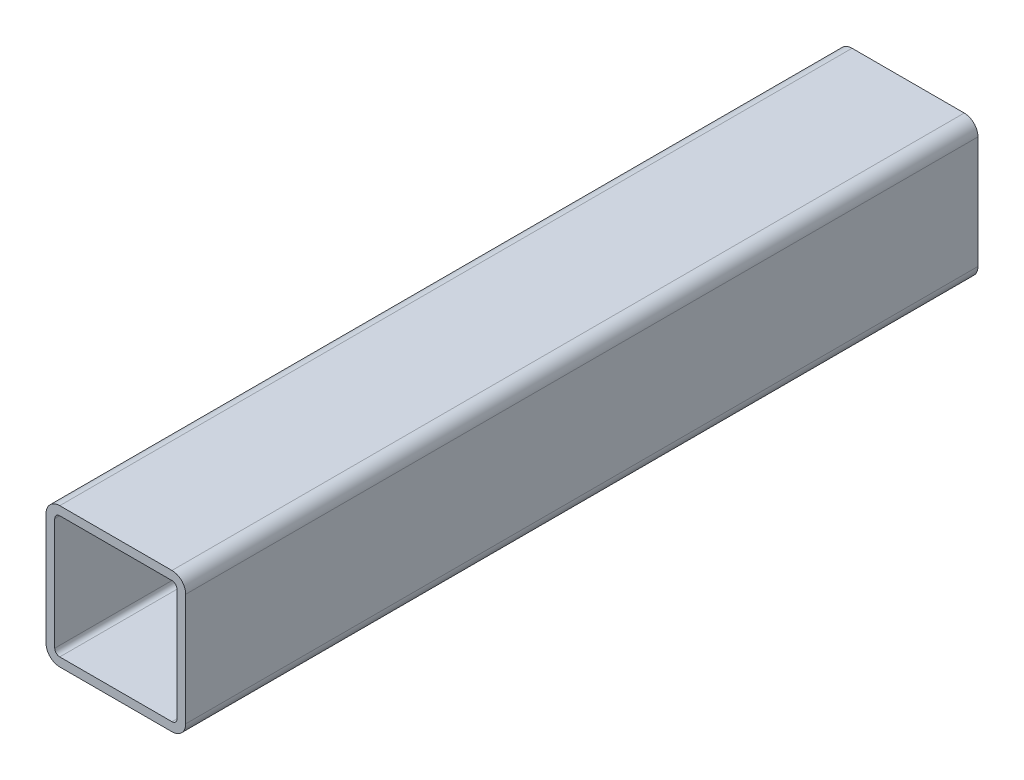
from build123d import *

# Parameters (mm, degrees)
BOSS_EXTRUDE1_DEPTH = 288.1


with BuildPart() as part:
    # Sketch1 → Boss-Extrude1 (new body)
    with BuildSketch(Plane.XY):
        with BuildLine():
            Line((-20.4, 25.4), (20.4, 25.4))
            ThreePointArc((20.4, 25.4), (23.935533906, 23.935533906), (25.4, 20.4))
            Line((25.4, 20.4), (25.4, -20.4))
            ThreePointArc((25.4, -20.4), (23.935533906, -23.935533906), (20.4, -25.4))
            Line((20.4, -25.4), (-20.4, -25.4))
            ThreePointArc((-20.4, -25.4), (-23.935533906, -23.935533906), (-25.4, -20.4))
            Line((-25.4, -20.4), (-25.4, 20.4))
            ThreePointArc((-25.4, 20.4), (-23.935533906, 23.935533906), (-20.4, 25.4))
        make_face()
        with BuildLine():
            Line((-22.225, 20.4), (-22.225, -20.4))
            ThreePointArc((-22.225, -20.4), (-21.690469876, -21.690469876), (-20.4, -22.225))
            Line((-20.4, -22.225), (20.4, -22.225))
            ThreePointArc((20.4, -22.225), (21.690469876, -21.690469876), (22.225, -20.4))
            Line((22.225, -20.4), (22.225, 20.4))
            ThreePointArc((22.225, 20.4), (21.690469876, 21.690469876), (20.4, 22.225))
            Line((20.4, 22.225), (-20.4, 22.225))
            ThreePointArc((-20.4, 22.225), (-21.690469876, 21.690469876), (-22.225, 20.4))
        make_face(mode=Mode.SUBTRACT)
    extrude(amount=BOSS_EXTRUDE1_DEPTH)


solid = part.part
